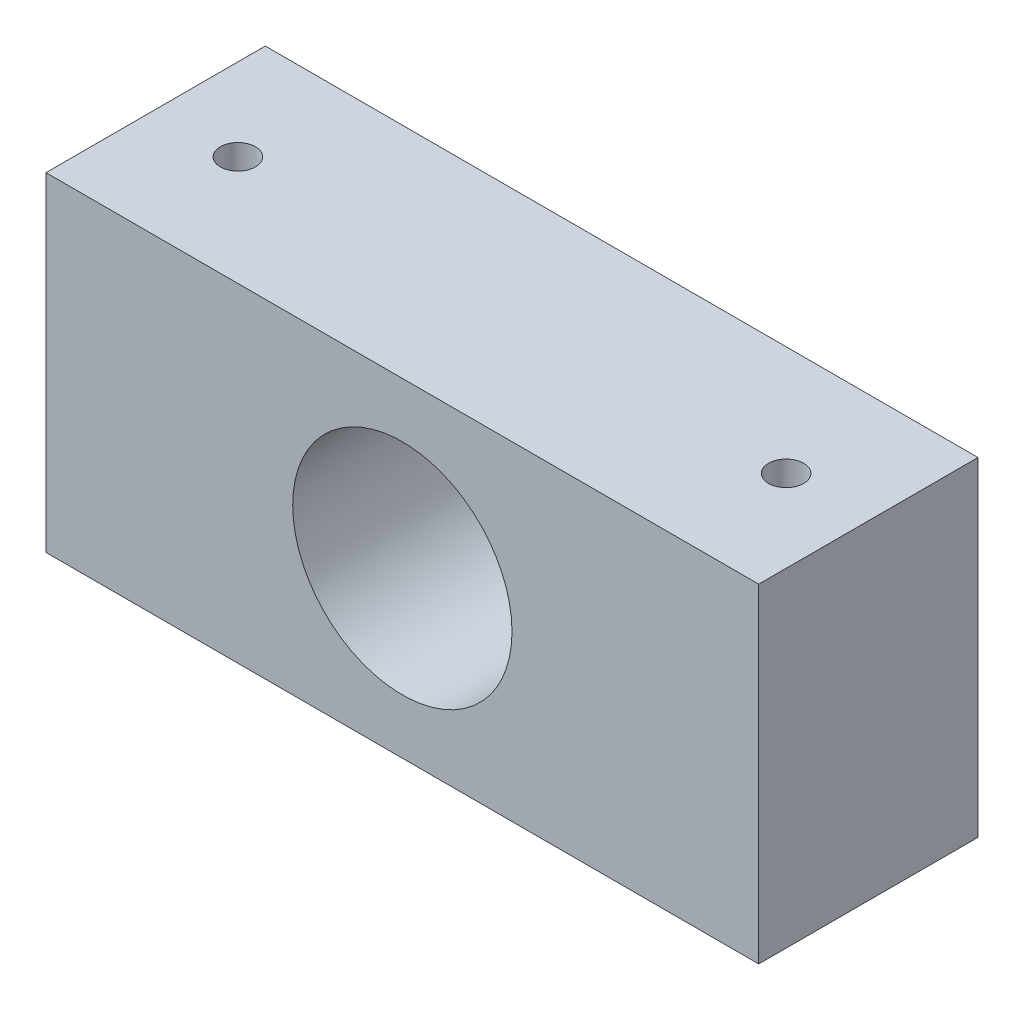
from build123d import *

# Parameters (mm, degrees)
SKETCH2_W               = 65
SKETCH2_H               = 30
SKETCH2_R               = 10
BOSS_EXTRUDE1_DEPTH     = 20
CUT_EXTRUDE1_DEPTH      = 75.330343737
CUT_EXTRUDE1_DEPTH_BACK = 75.330343737
SKETCH3_R               = 1.6


with BuildPart() as part:
    # Sketch2 → Boss-Extrude1 (new body)
    with BuildSketch(Plane.XY):
        with Locations((32.5, 15)):
            Rectangle(SKETCH2_W, SKETCH2_H)
        with Locations((32.5, 15)):
            Circle(SKETCH2_R, mode=Mode.SUBTRACT)
    extrude(amount=BOSS_EXTRUDE1_DEPTH)

    # Sketch3 → Cut-Extrude1 (cut, two sides: drawn at the far end of the back side and taken through both)
    with BuildSketch(Plane(origin=(0, 0, 0), x_dir=(1, 0, 0), z_dir=(0, 1, 0)).offset(-CUT_EXTRUDE1_DEPTH_BACK)):
        with Locations((7.5, -10)):
            Circle(SKETCH3_R)
        with Locations((57.5, -10)):
            Circle(SKETCH3_R)
    extrude(amount=CUT_EXTRUDE1_DEPTH + CUT_EXTRUDE1_DEPTH_BACK, mode=Mode.SUBTRACT)


solid = part.part
